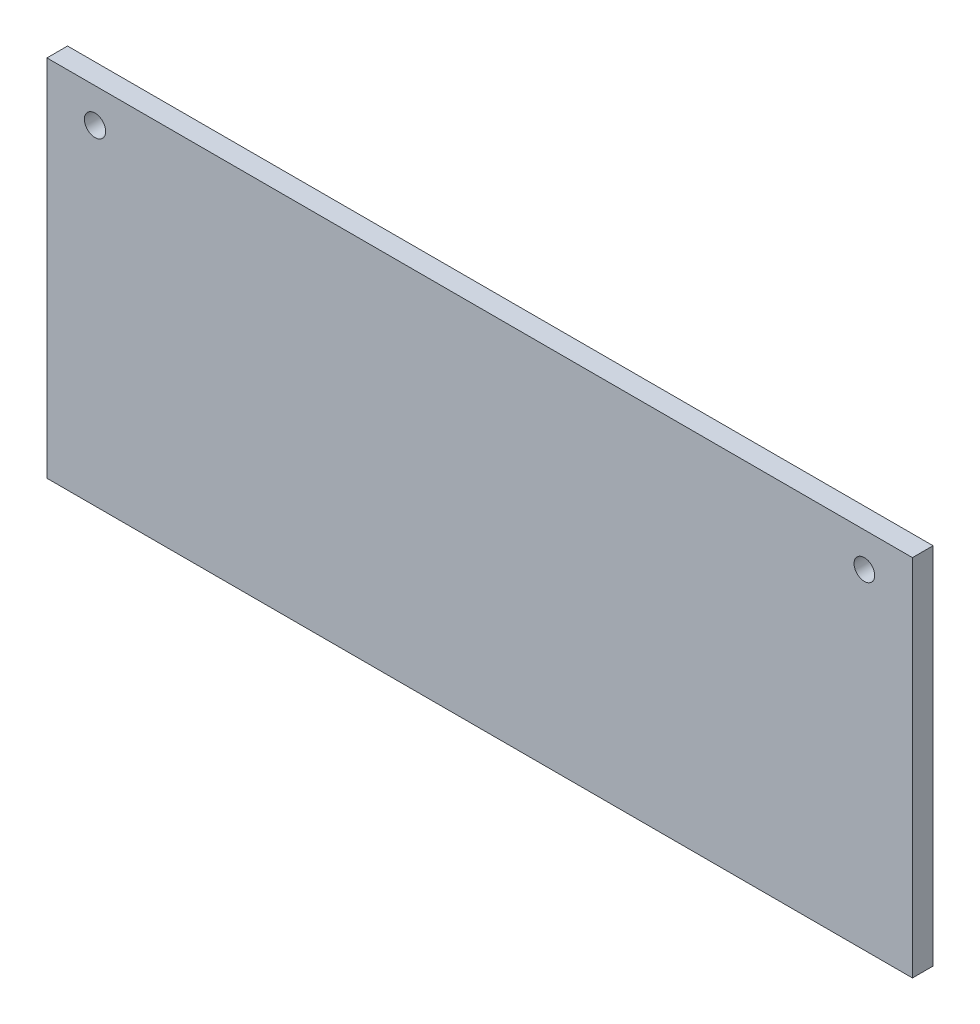
from build123d import *

# Parameters (mm, degrees)
SKETCH_1_W          = 126
SKETCH_1_H          = 53
EXTRUDE_1_DEPTH     = 3
SKETCH_2_R          = 1.55
SKETCH_2_R_2        = 1.5
CUT_EXTRUDE_1_DEPTH = 10


with BuildPart() as part:
    # 草图1 → 凸台-拉伸1 (new body)
    with BuildSketch(Plane.XY):
        Rectangle(SKETCH_1_W, SKETCH_1_H)
    extrude(amount=EXTRUDE_1_DEPTH)

    # 草图2 → 切除-拉伸1 (cut)
    with BuildSketch(Plane(origin=(0, 0, 0), x_dir=(-1, 0, 0), z_dir=(0, 0, -1))):
        with Locations((56, 21.5)):
            Circle(SKETCH_2_R)
        with Locations((-56, 21.5)):
            Circle(SKETCH_2_R_2)
    extrude(amount=-CUT_EXTRUDE_1_DEPTH, mode=Mode.SUBTRACT)


solid = part.part
